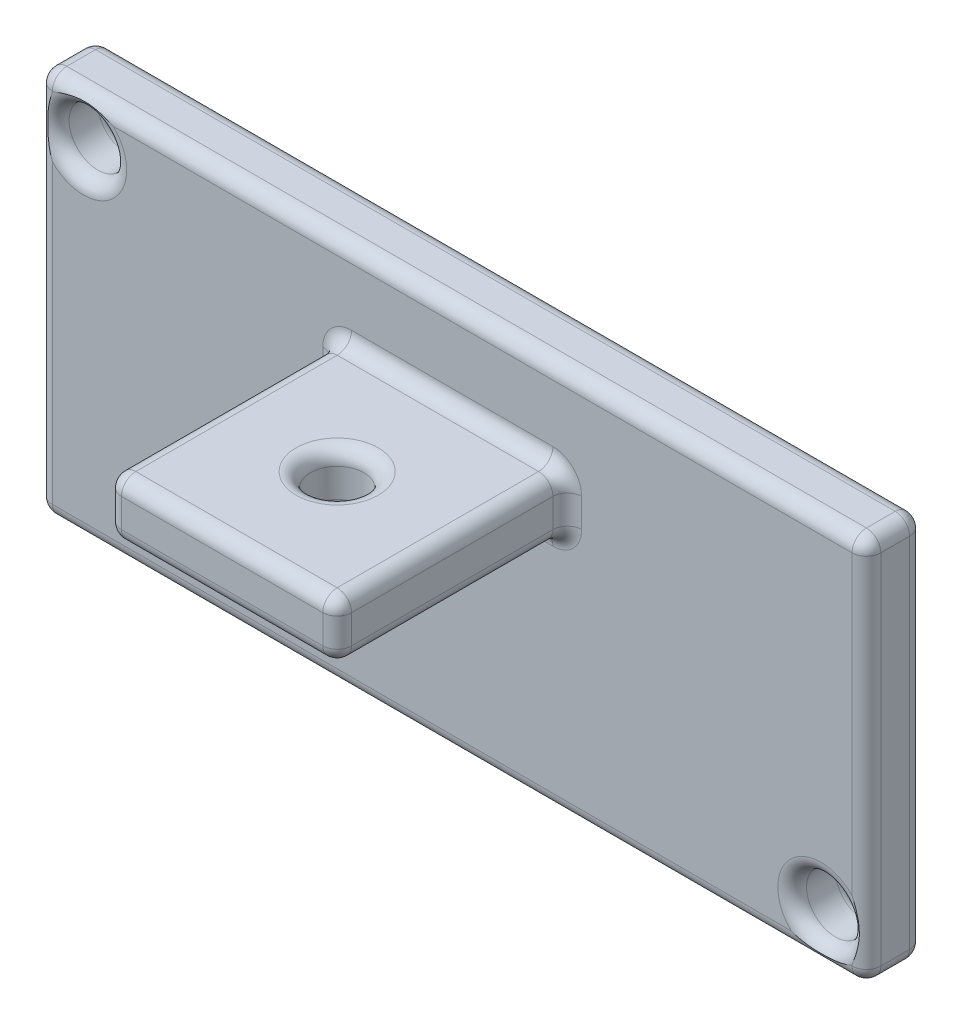
from build123d import *

# Parameters (mm, degrees)
SKETCH3_W           = 45.72
SKETCH3_H           = 21.336
BOSS_EXTRUDE1_DEPTH = 3.175
SKETCH4_R           = 1.5875
CUT_EXTRUDE1_DEPTH  = 3.175
SKETCH6_W           = 12.7
SKETCH6_H           = 3.175
BOSS_EXTRUDE2_DEPTH = 12.7
SKETCH7_R           = 1.4732
CUT_EXTRUDE2_DEPTH  = 3.175
FILLET1_R           = 0.79375


with BuildPart() as part:
    # Sketch3 → Boss-Extrude1 (new body)
    with BuildSketch(Plane.XY):
        Rectangle(SKETCH3_W, SKETCH3_H)
    extrude(amount=BOSS_EXTRUDE1_DEPTH)

    # Sketch4 → Cut-Extrude1 (cut)
    with BuildSketch(Plane.XY.offset(3.175)):
        with Locations((-20.35, 8.15)):
            Circle(SKETCH4_R)
        with Locations((20.35, -8.15)):
            Circle(SKETCH4_R)
    extrude(amount=-CUT_EXTRUDE1_DEPTH, mode=Mode.SUBTRACT)

    # Sketch6 → Boss-Extrude2 (add)
    with BuildSketch(Plane.XY.offset(3.175)):
        with Locations((0, 4.318)):
            Rectangle(SKETCH6_W, SKETCH6_H)
    extrude(amount=BOSS_EXTRUDE2_DEPTH)

    # Sketch7 → Cut-Extrude2 (cut)
    with BuildSketch(Plane(origin=(0, 5.9055, 0), x_dir=(1, 0, 0), z_dir=(0, 1, 0))):
        with Locations(Location((0, -9.525, 0), (0, 0, 270))):
            Circle(SKETCH7_R)
    extrude(amount=-CUT_EXTRUDE2_DEPTH, mode=Mode.SUBTRACT)

    # Fillet1
    # the kernel refuses this fillet: 0.79375 mm, written as the material it takes off along each edge
    with BuildSketch(Plane(origin=(-22.06625, 9.87425, 2.38125), x_dir=(0, 0, 1), z_dir=(-1, 0, 0))) as fillet1_piece_1_section:
        Polygon((0, 0), (FILLET1_R, 0), (FILLET1_R, FILLET1_R), (0, FILLET1_R), align=None)
    fillet1_piece_1 = extrude(amount=FILLET1_R, mode=Mode.PRIVATE)
    fillet1_piece_1 = fillet1_piece_1 - Plane(origin=(-22.06625, 9.87425, 2.38125), x_dir=(0, -0.7071067811865475, -0.7071067811865475), z_dir=(-1, 0, 0)) * Sphere(FILLET1_R, mode=Mode.PRIVATE)
    add(fillet1_piece_1, mode=Mode.SUBTRACT)
    with BuildSketch(Plane(origin=(-22.06625, -9.87425, 2.38125), x_dir=(-1, 0, 0), z_dir=(0, -1, 0))) as fillet1_piece_2_section:
        Polygon((0, 0), (FILLET1_R, 0), (FILLET1_R, -FILLET1_R), (0, -FILLET1_R), align=None)
    fillet1_piece_2 = extrude(amount=FILLET1_R, mode=Mode.PRIVATE)
    fillet1_piece_2 = fillet1_piece_2 - Plane(origin=(-22.06625, -9.87425, 2.38125), x_dir=(0.7071067811865475, 0, -0.7071067811865475), z_dir=(0, -1, 0)) * Sphere(FILLET1_R, mode=Mode.PRIVATE)
    add(fillet1_piece_2, mode=Mode.SUBTRACT)
    with BuildSketch(Plane(origin=(22.06625, -9.87425, 2.38125), x_dir=(1, 0, 0), z_dir=(0, -1, 0))) as fillet1_piece_3_section:
        Polygon((0, 0), (FILLET1_R, 0), (FILLET1_R, FILLET1_R), (0, FILLET1_R), align=None)
    fillet1_piece_3 = extrude(amount=FILLET1_R, mode=Mode.PRIVATE)
    fillet1_piece_3 = fillet1_piece_3 - Plane(origin=(22.06625, -9.87425, 2.38125), x_dir=(-0.7071067811865475, 0, -0.7071067811865475), z_dir=(0, -1, 0)) * Sphere(FILLET1_R, mode=Mode.PRIVATE)
    add(fillet1_piece_3, mode=Mode.SUBTRACT)
    with BuildSketch(Plane(origin=(5.55625, 3.52425, 15.08125), x_dir=(1, 0, 0), z_dir=(0, -1, 0))) as fillet1_piece_4_section:
        Polygon((0, 0), (FILLET1_R, 0), (FILLET1_R, FILLET1_R), (0, FILLET1_R), align=None)
    fillet1_piece_4 = extrude(amount=FILLET1_R, mode=Mode.PRIVATE)
    fillet1_piece_4 = fillet1_piece_4 - Plane(origin=(5.55625, 3.52425, 15.08125), x_dir=(-0.7071067811865475, 0, -0.7071067811865475), z_dir=(0, -1, 0)) * Sphere(FILLET1_R, mode=Mode.PRIVATE)
    add(fillet1_piece_4, mode=Mode.SUBTRACT)
    with BuildSketch(Plane(origin=(5.55625, 5.11175, 15.08125), x_dir=(0, 1, 0), z_dir=(1, 0, 0))) as fillet1_piece_5_section:
        Polygon((0, 0), (FILLET1_R, 0), (FILLET1_R, FILLET1_R), (0, FILLET1_R), align=None)
    fillet1_piece_5 = extrude(amount=FILLET1_R, mode=Mode.PRIVATE)
    fillet1_piece_5 = fillet1_piece_5 - Plane(origin=(5.55625, 5.11175, 15.08125), x_dir=(0, -0.7071067811865475, -0.7071067811865475), z_dir=(1, 0, 0)) * Sphere(FILLET1_R, mode=Mode.PRIVATE)
    add(fillet1_piece_5, mode=Mode.SUBTRACT)
    with BuildSketch(Plane(origin=(-5.55625, 5.11175, 15.08125), x_dir=(-1, 0, 0), z_dir=(0, 1, 0))) as fillet1_piece_6_section:
        Polygon((0, 0), (FILLET1_R, 0), (FILLET1_R, FILLET1_R), (0, FILLET1_R), align=None)
    fillet1_piece_6 = extrude(amount=FILLET1_R, mode=Mode.PRIVATE)
    fillet1_piece_6 = fillet1_piece_6 - Plane(origin=(-5.55625, 5.11175, 15.08125), x_dir=(0.7071067811865475, 0, -0.7071067811865475), z_dir=(0, 1, 0)) * Sphere(FILLET1_R, mode=Mode.PRIVATE)
    add(fillet1_piece_6, mode=Mode.SUBTRACT)
    with BuildSketch(Plane(origin=(-5.55625, 3.52425, 15.08125), x_dir=(-1, 0, 0), z_dir=(0, -1, 0))) as fillet1_piece_7_section:
        Polygon((0, 0), (FILLET1_R, 0), (FILLET1_R, -FILLET1_R), (0, -FILLET1_R), align=None)
    fillet1_piece_7 = extrude(amount=FILLET1_R, mode=Mode.PRIVATE)
    fillet1_piece_7 = fillet1_piece_7 - Plane(origin=(-5.55625, 3.52425, 15.08125), x_dir=(0.7071067811865475, 0, -0.7071067811865475), z_dir=(0, -1, 0)) * Sphere(FILLET1_R, mode=Mode.PRIVATE)
    add(fillet1_piece_7, mode=Mode.SUBTRACT)
    with BuildSketch(Plane(origin=(22.06625, 9.87425, 2.38125), x_dir=(0, 0, 1), z_dir=(1, 0, 0))) as fillet1_piece_8_section:
        Polygon((0, 0), (FILLET1_R, 0), (FILLET1_R, -FILLET1_R), (0, -FILLET1_R), align=None)
    fillet1_piece_8 = extrude(amount=FILLET1_R, mode=Mode.PRIVATE)
    fillet1_piece_8 = fillet1_piece_8 - Plane(origin=(22.06625, 9.87425, 2.38125), x_dir=(0, -0.7071067811865475, -0.7071067811865475), z_dir=(1, 0, 0)) * Sphere(FILLET1_R, mode=Mode.PRIVATE)
    add(fillet1_piece_8, mode=Mode.SUBTRACT)
    with BuildSketch(Plane(origin=(-22.06625, -9.87425, 0.79375), x_dir=(-1, 0, 0), z_dir=(0, -1, 0))) as fillet1_piece_9_section:
        Polygon((0, 0), (FILLET1_R, 0), (FILLET1_R, FILLET1_R), (0, FILLET1_R), align=None)
    fillet1_piece_9 = extrude(amount=FILLET1_R, mode=Mode.PRIVATE)
    fillet1_piece_9 = fillet1_piece_9 - Plane(origin=(-22.06625, -9.87425, 0.79375), x_dir=(0.7071067811865475, 0, 0.7071067811865475), z_dir=(0, -1, 0)) * Sphere(FILLET1_R, mode=Mode.PRIVATE)
    add(fillet1_piece_9, mode=Mode.SUBTRACT)
    with BuildSketch(Plane(origin=(22.06625, -9.87425, 0.79375), x_dir=(1, 0, 0), z_dir=(0, -1, 0))) as fillet1_piece_10_section:
        Polygon((0, 0), (FILLET1_R, 0), (FILLET1_R, -FILLET1_R), (0, -FILLET1_R), align=None)
    fillet1_piece_10 = extrude(amount=FILLET1_R, mode=Mode.PRIVATE)
    fillet1_piece_10 = fillet1_piece_10 - Plane(origin=(22.06625, -9.87425, 0.79375), x_dir=(-0.7071067811865475, 0, 0.7071067811865475), z_dir=(0, -1, 0)) * Sphere(FILLET1_R, mode=Mode.PRIVATE)
    add(fillet1_piece_10, mode=Mode.SUBTRACT)
    with BuildSketch(Plane(origin=(-22.06625, 9.87425, 0.79375), x_dir=(0, 0, -1), z_dir=(-1, 0, 0))) as fillet1_piece_11_section:
        Polygon((0, 0), (FILLET1_R, 0), (FILLET1_R, -FILLET1_R), (0, -FILLET1_R), align=None)
    fillet1_piece_11 = extrude(amount=FILLET1_R, mode=Mode.PRIVATE)
    fillet1_piece_11 = fillet1_piece_11 - Plane(origin=(-22.06625, 9.87425, 0.79375), x_dir=(0, -0.7071067811865475, 0.7071067811865475), z_dir=(-1, 0, 0)) * Sphere(FILLET1_R, mode=Mode.PRIVATE)
    add(fillet1_piece_11, mode=Mode.SUBTRACT)
    with BuildSketch(Plane(origin=(22.06625, 9.87425, 0.79375), x_dir=(0, 0, -1), z_dir=(1, 0, 0))) as fillet1_piece_12_section:
        Polygon((0, 0), (FILLET1_R, 0), (FILLET1_R, FILLET1_R), (0, FILLET1_R), align=None)
    fillet1_piece_12 = extrude(amount=FILLET1_R, mode=Mode.PRIVATE)
    fillet1_piece_12 = fillet1_piece_12 - Plane(origin=(22.06625, 9.87425, 0.79375), x_dir=(0, -0.7071067811865475, 0.7071067811865475), z_dir=(1, 0, 0)) * Sphere(FILLET1_R, mode=Mode.PRIVATE)
    add(fillet1_piece_12, mode=Mode.SUBTRACT)
    with BuildSketch(Plane(origin=(-22.86, 9.87425, 3.175), x_dir=(0, 0, -1), z_dir=(0, -1, 0)), Plane(origin=(22.86, -9.87425, 3.175), x_dir=(0, 0, -1), z_dir=(0, 1, 0))) as fillet1_piece_13:
        with BuildLine():
            CenterArc((FILLET1_R, FILLET1_R), FILLET1_R, 180, 90)
            Line((0, FILLET1_R), (0, 0))
            Line((0, 0), (FILLET1_R, 0))
        make_face()
    extrude(amount=19.7485, mode=Mode.SUBTRACT)
    with BuildSketch(Plane(origin=(-22.06625, -10.668, 3.175), x_dir=(0, 0, -1), z_dir=(1, 0, 0)), Plane(origin=(22.06625, 10.668, 0), x_dir=(0, -1, 0), z_dir=(-1, 0, 0))) as fillet1_piece_14:
        with BuildLine():
            CenterArc((FILLET1_R, FILLET1_R), FILLET1_R, 180, 90)
            Line((0, FILLET1_R), (0, 0))
            Line((0, 0), (FILLET1_R, 0))
        make_face()
    extrude(amount=44.1325, mode=Mode.SUBTRACT)
    with BuildSketch(Plane(origin=(-20.35, 8.15, 3.175), x_dir=(1, 0, 0), z_dir=(0, -1, 0))) as fillet1_piece_15:
        with BuildLine():
            CenterArc((1.5875 + FILLET1_R, -FILLET1_R), FILLET1_R, 90, 90)
            Line((1.5875, -FILLET1_R), (1.5875, 0))
            Line((1.5875, 0), (1.5875 + FILLET1_R, 0))
        make_face()
    revolve(axis=Axis((-20.35, 8.15, 3.175), (0, 0, 1)), mode=Mode.SUBTRACT)
    with BuildSketch(Plane(origin=(-20.35, 8.15, 0), x_dir=(1, 0, 0), z_dir=(0, -1, 0))) as fillet1_piece_16:
        with BuildLine():
            CenterArc((1.5875 + FILLET1_R, FILLET1_R), FILLET1_R, 180, 90)
            Line((1.5875, FILLET1_R), (1.5875, 0))
            Line((1.5875, 0), (1.5875 + FILLET1_R, 0))
        make_face()
    revolve(axis=Axis((-20.35, 8.15, 0), (0, 0, 1)), mode=Mode.SUBTRACT)
    with BuildSketch(Plane(origin=(20.35, -8.15, 3.175), x_dir=(1, 0, 0), z_dir=(0, -1, 0))) as fillet1_piece_17:
        with BuildLine():
            CenterArc((1.5875 + FILLET1_R, -FILLET1_R), FILLET1_R, 90, 90)
            Line((1.5875, -FILLET1_R), (1.5875, 0))
            Line((1.5875, 0), (1.5875 + FILLET1_R, 0))
        make_face()
    revolve(axis=Axis((20.35, -8.15, 3.175), (0, 0, 1)), mode=Mode.SUBTRACT)
    with BuildSketch(Plane(origin=(20.35, -8.15, 0), x_dir=(1, 0, 0), z_dir=(0, -1, 0))) as fillet1_piece_18:
        with BuildLine():
            CenterArc((1.5875 + FILLET1_R, FILLET1_R), FILLET1_R, 180, 90)
            Line((1.5875, FILLET1_R), (1.5875, 0))
            Line((1.5875, 0), (1.5875 + FILLET1_R, 0))
        make_face()
    revolve(axis=Axis((20.35, -8.15, 0), (0, 0, 1)), mode=Mode.SUBTRACT)
    with BuildSketch(Plane(origin=(6.35, 2.7305, 3.175), x_dir=(-1, 0, 0), z_dir=(0, 0, 1)), Plane(origin=(6.35, 5.9055, 3.175), x_dir=(0, -1, 0), z_dir=(0, 0, 1)), Plane(origin=(-6.35, 5.9055, 3.175), x_dir=(1, 0, 0), z_dir=(0, 0, 1))) as fillet1_piece_19:
        with BuildLine():
            CenterArc((FILLET1_R, -FILLET1_R), FILLET1_R, 90, 90)
            Line((0, -FILLET1_R), (0, 0))
            Line((0, 0), (FILLET1_R, 0))
        make_face()
    extrude(amount=11.90625, mode=Mode.SUBTRACT)
    with BuildSketch(Plane(origin=(-6.35, 2.7305, 3.175), x_dir=(1, 0, 0), z_dir=(0, 0, 1))) as fillet1_piece_20:
        with BuildLine():
            CenterArc((FILLET1_R, FILLET1_R), FILLET1_R, 180, 90)
            Line((0, FILLET1_R), (0, 0))
            Line((0, 0), (FILLET1_R, 0))
        make_face()
    extrude(amount=11.90625, mode=Mode.SUBTRACT)
    with BuildSketch(Plane(origin=(6.35, 3.52425, 15.875), x_dir=(0, 0, -1), z_dir=(0, 1, 0)), Plane(origin=(-6.35, 5.11175, 15.875), x_dir=(0, 0, -1), z_dir=(0, -1, 0)), Plane(origin=(-22.86, -10.668, 0.79375), x_dir=(1, 0, 0), z_dir=(0, 0, 1)), Plane(origin=(-22.86, 10.668, 0.79375), x_dir=(0, -1, 0), z_dir=(0, 0, 1))) as fillet1_piece_21:
        with BuildLine():
            CenterArc((FILLET1_R, FILLET1_R), FILLET1_R, 180, 90)
            Line((0, FILLET1_R), (0, 0))
            Line((0, 0), (FILLET1_R, 0))
        make_face()
    extrude(amount=1.5875, mode=Mode.SUBTRACT)
    with BuildSketch(Plane(origin=(5.55625, 5.9055, 15.875), x_dir=(0, 0, -1), z_dir=(-1, 0, 0)), Plane(origin=(-5.55625, 2.7305, 15.875), x_dir=(0, 0, -1), z_dir=(1, 0, 0))) as fillet1_piece_22:
        with BuildLine():
            CenterArc((FILLET1_R, FILLET1_R), FILLET1_R, 180, 90)
            Line((0, FILLET1_R), (0, 0))
            Line((0, 0), (FILLET1_R, 0))
        make_face()
    extrude(amount=11.1125, mode=Mode.SUBTRACT)
    with BuildSketch(Plane(origin=(0, 5.9055, 9.525), x_dir=(0, 0, 1), z_dir=(-1, 0, 0))) as fillet1_piece_23:
        with BuildLine():
            CenterArc((1.4732 + FILLET1_R, -FILLET1_R), FILLET1_R, 90, 90)
            Line((1.4732, -FILLET1_R), (1.4732, 0))
            Line((1.4732, 0), (1.4732 + FILLET1_R, 0))
        make_face()
    revolve(axis=Axis((0, 5.9055, 9.525), (0, 1, 0)), mode=Mode.SUBTRACT)
    with BuildSketch(Plane(origin=(0, 2.7305, 9.525), x_dir=(0, 0, 1), z_dir=(-1, 0, 0))) as fillet1_piece_24:
        with BuildLine():
            CenterArc((1.4732 + FILLET1_R, FILLET1_R), FILLET1_R, 180, 90)
            Line((1.4732, FILLET1_R), (1.4732, 0))
            Line((1.4732, 0), (1.4732 + FILLET1_R, 0))
        make_face()
    revolve(axis=Axis((0, 2.7305, 9.525), (0, 1, 0)), mode=Mode.SUBTRACT)
    with BuildSketch(Plane(origin=(-22.06625, -10.668, 0), x_dir=(0, 0, 1), z_dir=(1, 0, 0)), Plane(origin=(22.06625, 10.668, 3.175), x_dir=(0, -1, 0), z_dir=(-1, 0, 0))) as fillet1_piece_25:
        with BuildLine():
            CenterArc((FILLET1_R, -FILLET1_R), FILLET1_R, 90, 90)
            Line((0, -FILLET1_R), (0, 0))
            Line((0, 0), (FILLET1_R, 0))
        make_face()
    extrude(amount=44.1325, mode=Mode.SUBTRACT)
    with BuildSketch(Plane(origin=(-22.86, 9.87425, 0), x_dir=(0, 0, 1), z_dir=(0, -1, 0)), Plane(origin=(22.86, -9.87425, 0), x_dir=(0, 0, 1), z_dir=(0, 1, 0))) as fillet1_piece_26:
        with BuildLine():
            CenterArc((FILLET1_R, -FILLET1_R), FILLET1_R, 90, 90)
            Line((0, -FILLET1_R), (0, 0))
            Line((0, 0), (FILLET1_R, 0))
        make_face()
    extrude(amount=19.7485, mode=Mode.SUBTRACT)
    with BuildSketch(Plane(origin=(22.86, -10.668, 0.79375), x_dir=(-1, 0, 0), z_dir=(0, 0, 1)), Plane(origin=(22.86, 10.668, 0.79375), x_dir=(0, -1, 0), z_dir=(0, 0, 1))) as fillet1_piece_27:
        with BuildLine():
            CenterArc((FILLET1_R, -FILLET1_R), FILLET1_R, 90, 90)
            Line((0, -FILLET1_R), (0, 0))
            Line((0, 0), (FILLET1_R, 0))
        make_face()
    extrude(amount=1.5875, mode=Mode.SUBTRACT)
    # the kernel refuses this fillet: 0.79375 mm, written as the material it adds along each edge
    with BuildSketch(Plane(origin=(6.35, 3.52425, 3.175), x_dir=(1, 0, 0), z_dir=(0, 1, 0)), Plane(origin=(-6.35, 5.11175, 3.175), x_dir=(-1, 0, 0), z_dir=(0, -1, 0))) as fillet1_2_piece_1:
        with BuildLine():
            CenterArc((FILLET1_R, -FILLET1_R), FILLET1_R, 90, 90)
            Line((0, -FILLET1_R), (0, 0))
            Line((0, 0), (FILLET1_R, 0))
        make_face()
    extrude(amount=1.5875)
    with BuildSketch(Plane(origin=(5.55625, 5.9055, 3.175), x_dir=(0, 1, 0), z_dir=(-1, 0, 0)), Plane(origin=(-5.55625, 2.7305, 3.175), x_dir=(0, -1, 0), z_dir=(1, 0, 0))) as fillet1_2_piece_2:
        with BuildLine():
            CenterArc((FILLET1_R, -FILLET1_R), FILLET1_R, 90, 90)
            Line((0, -FILLET1_R), (0, 0))
            Line((0, 0), (FILLET1_R, 0))
        make_face()
    extrude(amount=11.1125)
    with BuildSketch(Plane(origin=(-5.55625, 3.52425, 3.175), x_dir=(0, -1, 0), z_dir=(1, 0, 0))) as fillet1_2_piece_3:
        with BuildLine():
            CenterArc((0.79375 + FILLET1_R, -FILLET1_R), FILLET1_R, 90, 90)
            Line((0.79375, -FILLET1_R), (0.79375, 0))
            Line((0.79375, 0), (0.79375 + FILLET1_R, 0))
        make_face()
    revolve(axis=Axis((-5.55625, 3.52425, 3.175), (0, 0, -1)), revolution_arc=90)
    with BuildSketch(Plane(origin=(5.55625, 3.52425, 3.175), x_dir=(0, -1, 0), z_dir=(-1, 0, 0))) as fillet1_2_piece_4:
        with BuildLine():
            CenterArc((0.79375 + FILLET1_R, FILLET1_R), FILLET1_R, 180, 90)
            Line((0.79375, FILLET1_R), (0.79375, 0))
            Line((0.79375, 0), (0.79375 + FILLET1_R, 0))
        make_face()
    revolve(axis=Axis((5.55625, 3.52425, 3.175), (0, 0, 1)), revolution_arc=90)
    with BuildSketch(Plane(origin=(-5.55625, 5.11175, 3.175), x_dir=(0, 1, 0), z_dir=(1, 0, 0))) as fillet1_2_piece_5:
        with BuildLine():
            CenterArc((0.79375 + FILLET1_R, FILLET1_R), FILLET1_R, 180, 90)
            Line((0.79375, FILLET1_R), (0.79375, 0))
            Line((0.79375, 0), (0.79375 + FILLET1_R, 0))
        make_face()
    revolve(axis=Axis((-5.55625, 5.11175, 3.175), (0, 0, 1)), revolution_arc=90)
    with BuildSketch(Plane(origin=(5.55625, 5.11175, 3.175), x_dir=(1, 0, 0), z_dir=(0, -1, 0))) as fillet1_2_piece_6:
        with BuildLine():
            CenterArc((0.79375 + FILLET1_R, FILLET1_R), FILLET1_R, 180, 90)
            Line((0.79375, FILLET1_R), (0.79375, 0))
            Line((0.79375, 0), (0.79375 + FILLET1_R, 0))
        make_face()
    revolve(axis=Axis((5.55625, 5.11175, 3.175), (0, 0, 1)), revolution_arc=90)


solid = part.part
